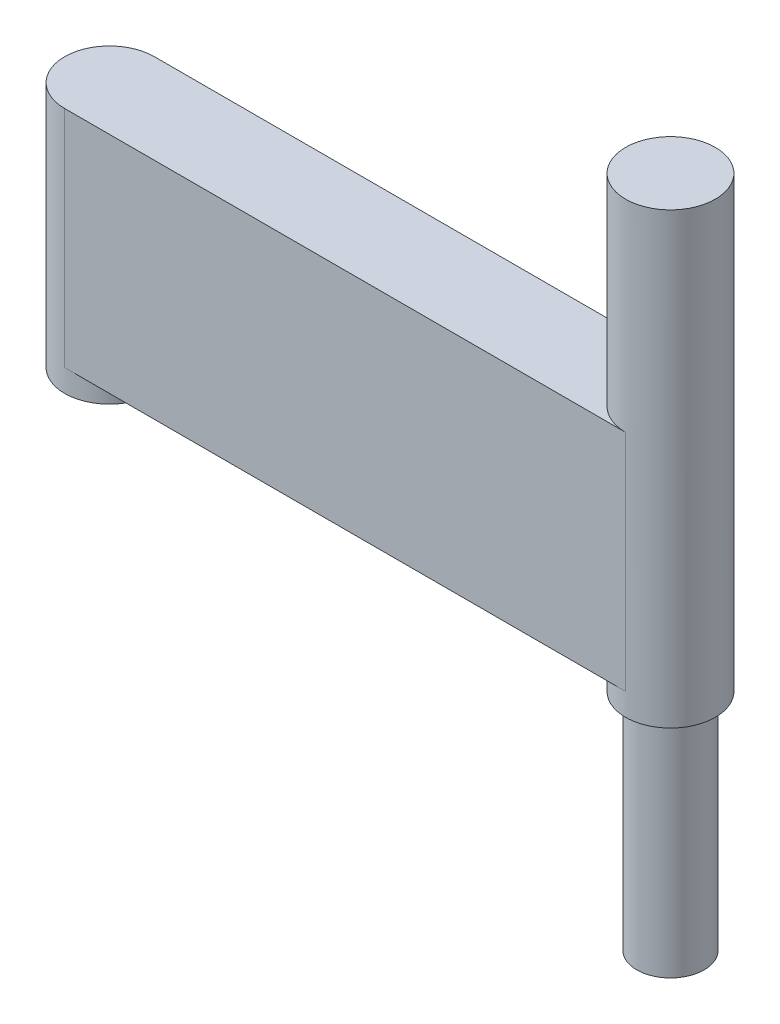
from build123d import *
from build123d.topology import SkipClean

# Parameters (mm, degrees)
SKETCH1_R           = 20
BOSS_EXTRUDE1_DEPTH = 10
BOSS_EXTRUDE2_DEPTH = 100
BOSS_EXTRUDE3_START = 10
SKETCH3_R           = 20
BOSS_EXTRUDE3_DEPTH = 10
SKETCH6_R           = 20
BOSS_EXTRUDE5_DEPTH = 90
SKETCH9_R           = 15
BOSS_EXTRUDE6_DEPTH = 100


with BuildPart() as part:
    # Sketch1 → Boss-Extrude1 (new body)
    with BuildSketch(Plane(origin=(0, 0, 0), x_dir=(1, 0, 0), z_dir=(0, 1, 0))):
        with Locations(Location((0, 0, 0), (0, 0, 270))):
            Circle(SKETCH1_R)
    extrude(amount=BOSS_EXTRUDE1_DEPTH)

    # Sketch2 → Boss-Extrude2 (add)
    with BuildSketch(Plane(origin=(0, 10, 0), x_dir=(1, 0, 0), z_dir=(0, 1, 0))):
        with BuildLine():
            Line((0, -20), (250, -20))
            ThreePointArc((250, -20), (270, 0), (250, 20))
            Line((250, 20), (0, 20))
            ThreePointArc((0, 20), (-20, 0), (0, -20))
        make_face()
    extrude(amount=BOSS_EXTRUDE2_DEPTH)

    # Sketch3 → Boss-Extrude3 (add)
    with SkipClean():  # the faces are left unmerged after this step: merging them gives an invalid solid
        with BuildSketch(Plane.XZ.offset(-10).offset(BOSS_EXTRUDE3_START)):
            with Locations(Location((250, 0, 0), (0, 0, 270))):
                Circle(SKETCH3_R)
        extrude(amount=-BOSS_EXTRUDE3_DEPTH)

    # Sketch6 → Boss-Extrude5 (add)
    with BuildSketch(Plane(origin=(0, 110, 0), x_dir=(1, 0, 0), z_dir=(0, 1, 0))):
        with Locations(Location((250, 0, 0), (0, 0, 90))):
            Circle(SKETCH6_R)
    extrude(amount=BOSS_EXTRUDE5_DEPTH)

    # Sketch9 → Boss-Extrude6 (add)
    with BuildSketch(Plane.XZ):
        with Locations(Location((250, 0, 0), (0, 0, 270))):
            Circle(SKETCH9_R)
    extrude(amount=BOSS_EXTRUDE6_DEPTH)


solid = part.part
